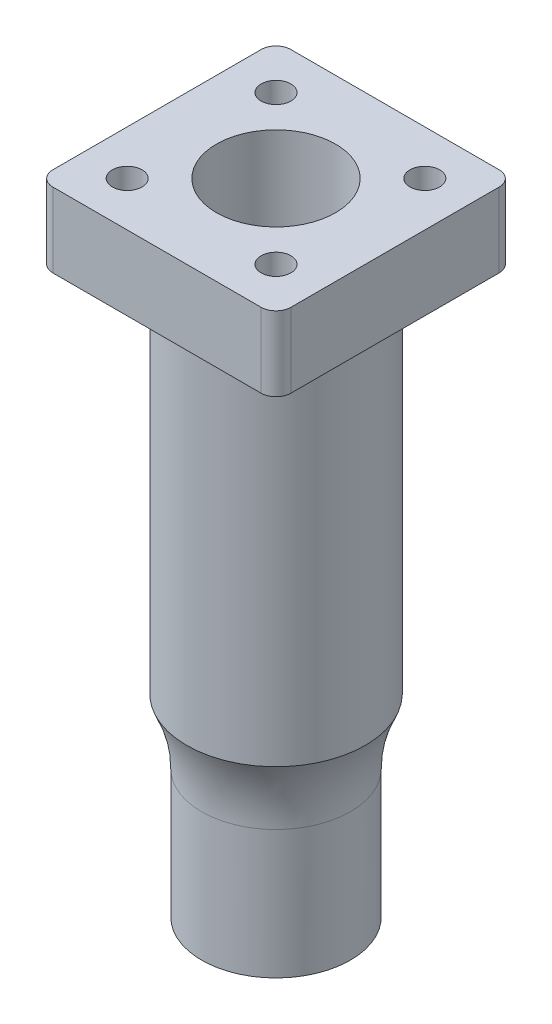
from build123d import *

# Parameters (mm, degrees)
SKETCH1_R           = 5
SKETCH1_R_2         = 2.25
BOSS_EXTRUDE1_DEPTH = 3
BOSS_EXTRUDE2_START = 10
SKETCH2_R           = 5
SKETCH2_R_2         = 3
BOSS_EXTRUDE2_DEPTH = 10
SKETCH3_R           = 6
SKETCH3_R_2         = 4
BOSS_EXTRUDE3_DEPTH = 30
FILLET1_R           = 10
BOSS_EXTRUDE4_START = -5
SKETCH4_R           = 4
SKETCH4_R_2         = 1
BOSS_EXTRUDE4_DEPTH = 5


with BuildPart() as part:
    # Sketch1 → Boss-Extrude1 (new body)
    with BuildSketch(Plane(origin=(0, 0, 0), x_dir=(1, 0, 0), z_dir=(0, 1, 0))):
        with Locations(Location((0, 0, 0), (0, 0, 270))):
            Circle(SKETCH1_R)
        with Locations(Location((0, 0, 0), (0, 0, 270))):
            Circle(SKETCH1_R_2, mode=Mode.SUBTRACT)
    extrude(amount=BOSS_EXTRUDE1_DEPTH)

    # Sketch2 → Boss-Extrude2 (add)
    with BuildSketch(Plane.XZ.offset(BOSS_EXTRUDE2_START)):
        with Locations(Location((0, 0, 0), (0, 0, 270))):
            Circle(SKETCH2_R)
        with Locations(Location((0, 0, 0), (0, 0, 270))):
            Circle(SKETCH2_R_2, mode=Mode.SUBTRACT)
    extrude(amount=-BOSS_EXTRUDE2_DEPTH)

    # Sketch3 → Boss-Extrude3 (add)
    with BuildSketch(Plane(origin=(0, 3, 0), x_dir=(1, 0, 0), z_dir=(0, 1, 0))):
        with Locations(Location((0, 0, 0), (0, 0, 270))):
            Circle(SKETCH3_R)
        with Locations(Location((0, 0, 0), (0, 0, 270))):
            Circle(SKETCH3_R_2, mode=Mode.SUBTRACT)
    extrude(amount=BOSS_EXTRUDE3_DEPTH)

    # Fillet1
    # the kernel refuses this fillet: 10 mm, written as the material it adds along each edge
    with BuildSketch(Plane(origin=(0, 3, 0), x_dir=(0, 0, 1), z_dir=(-1, 0, 0))) as fillet1_piece_1:
        with BuildLine():
            CenterArc((15, -4.358898944), FILLET1_R, 154.158067237, 25.841932763)
            Line((6, 0), (5.82, 0.087177979))
            ThreePointArc((5.82, 0.087177979), (5.5, 0.2), (5, 0.2))
            Line((5, 0.2), (4.8, 0))
            Line((4.8, 0), (4.8, -4.358898944))
            Line((4.8, -4.358898944), (5, -4.358898944))
        make_face()
    revolve(axis=Axis((0, 3, 0), (0, 1, 0)))

    # Sketch4 → Boss-Extrude4 (add)
    with BuildSketch(Plane(origin=(0, 33, 0), x_dir=(1, 0, 0), z_dir=(0, 1, 0)).offset(BOSS_EXTRUDE4_START)):
        with BuildLine():
            Line((-8, 0), (-8, 7))
            ThreePointArc((-8, 7), (-7.707106781, 7.707106781), (-7, 8))
            Line((-7, 8), (7, 8))
            ThreePointArc((7, 8), (7.707106781, 7.707106781), (8, 7))
            Line((8, 7), (8, -7))
            ThreePointArc((8, -7), (7.707106781, -7.707106781), (7, -8))
            Line((7, -8), (-7, -8))
            ThreePointArc((-7, -8), (-7.707106781, -7.707106781), (-8, -7))
            Line((-8, -7), (-8, 0))
        make_face()
        with Locations(Location((0, 0, 0), (0, 0, 270))):
            Circle(SKETCH4_R, mode=Mode.SUBTRACT)
        with Locations(Location((-5, 5, 0), (0, 0, 270))):
            Circle(SKETCH4_R_2, mode=Mode.SUBTRACT)
        with Locations(Location((5, 5, 0), (0, 0, 270))):
            Circle(SKETCH4_R_2, mode=Mode.SUBTRACT)
        with Locations(Location((-5, -5, 0), (0, 0, 270))):
            Circle(SKETCH4_R_2, mode=Mode.SUBTRACT)
        with Locations(Location((5, -5, 0), (0, 0, 270))):
            Circle(SKETCH4_R_2, mode=Mode.SUBTRACT)
    extrude(amount=BOSS_EXTRUDE4_DEPTH)


solid = part.part
